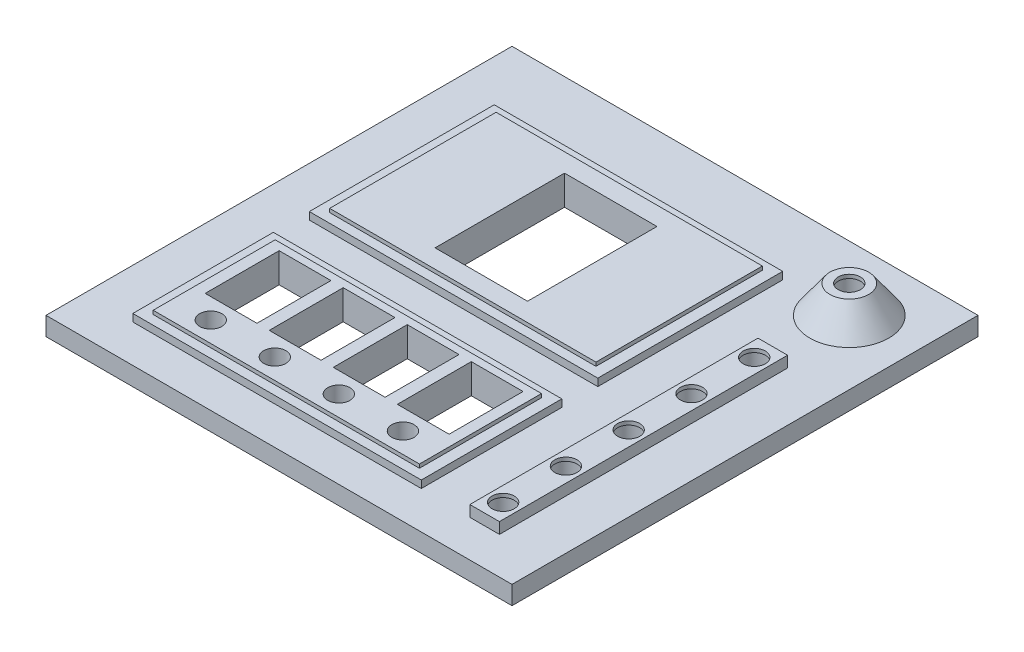
from build123d import *

# Parameters (mm, degrees)
SKETCH1_W           = 126
SKETCH1_H           = 126
BOSS_EXTRUDE1_DEPTH = 5
SKETCH3_R           = 12.5
BOSS_EXTRUDE2_DEPTH = 7.5
SKETCH4_R           = 3.45
CUT_EXTRUDE1_DEPTH  = 11.5
SKETCH6_R           = 3
CUT_EXTRUDE2_DEPTH  = 179.628805068
CHAMFER1_SIZE       = 10
CHAMFER1_SIZE_2     = 7.26542528
SKETCH7_W           = 8
SKETCH7_H           = 77.91635632
BOSS_EXTRUDE3_DEPTH = 3
SKETCH8_R           = 3
CUT_EXTRUDE3_DEPTH  = 179.370401132
SKETCH9_R           = 3.45
CUT_EXTRUDE4_DEPTH  = 7
SKETCH12_W          = 78
SKETCH12_H          = 50
SKETCH12_H_2        = 38
BOSS_EXTRUDE4_DEPTH = 2
SKETCH13_W          = 72
SKETCH13_H          = 45
BOSS_EXTRUDE5_DEPTH = 1
SKETCH14_W          = 72
SKETCH14_H          = 33
BOSS_EXTRUDE6_DEPTH = 1
SKETCH17_W          = 25
SKETCH17_H          = 35
CUT_EXTRUDE6_DEPTH  = 179.370401132
SKETCH18_W          = 14
SKETCH18_H          = 20
CUT_EXTRUDE7_DEPTH  = 179.370401132
SKETCH19_R          = 3
CUT_EXTRUDE8_DEPTH  = 179.370401132


with BuildPart() as part:
    # Sketch1 → Boss-Extrude1 (new body)
    with BuildSketch(Plane(origin=(0, 0, 0), x_dir=(1, 0, 0), z_dir=(0, 1, 0))):
        with Locations((63, 63)):
            Rectangle(SKETCH1_W, SKETCH1_H)
    extrude(amount=BOSS_EXTRUDE1_DEPTH)

    # Sketch3 → Boss-Extrude2 (add)
    with BuildSketch(Plane(origin=(0, 5, 0), x_dir=(1, 0, 0), z_dir=(0, 1, 0))):
        with Locations(Location((108.6, 108.6, 0), (0, 0, 90))):
            Circle(SKETCH3_R)
    extrude(amount=BOSS_EXTRUDE2_DEPTH)

    # Sketch4 → Cut-Extrude1 (cut)
    with BuildSketch(Plane.XZ):
        with Locations(Location((108.6, -108.6, 0), (0, 0, 270))):
            Circle(SKETCH4_R)
    extrude(amount=-CUT_EXTRUDE1_DEPTH, mode=Mode.SUBTRACT)

    # Sketch6 → Cut-Extrude2 (cut, through all)
    with BuildSketch(Plane(origin=(0, 12.5, 0), x_dir=(1, 0, 0), z_dir=(0, 1, 0))):
        with Locations(Location((108.6, 108.6, 0), (0, 0, 270))):
            Circle(SKETCH6_R)
    extrude(amount=-CUT_EXTRUDE2_DEPTH, mode=Mode.SUBTRACT)

    # Chamfer1
    # the kernel refuses this chamfer: 10, 7.26542528 mm, written as the material it takes off along each edge
    with BuildSketch(Plane(origin=(108.6, 12.5, -108.6), x_dir=(0, 0, -1), z_dir=(1, 0, 0))) as chamfer1_piece_1_section:
        Polygon((12.5, -CHAMFER1_SIZE), (12.5 - CHAMFER1_SIZE_2, 0), (12.5, 0), align=None)
    chamfer1_piece_1 = revolve(axis=Axis((108.6, 12.5, -108.6), (0, 1, 0)), mode=Mode.PRIVATE)
    chamfer1_piece_1 = split(chamfer1_piece_1, bisect_by=Plane(origin=(108.6, 5, -100.650989912), z_dir=(0, 1, 0)), keep=Keep.TOP, mode=Mode.PRIVATE)
    add(chamfer1_piece_1, mode=Mode.SUBTRACT)

    # Sketch7 → Boss-Extrude3 (add)
    with BuildSketch(Plane(origin=(0, 5, 0), x_dir=(1, 0, 0), z_dir=(0, 1, 0))):
        with Locations((108.6, 48.95817816)):
            Rectangle(SKETCH7_W, SKETCH7_H)
    extrude(amount=BOSS_EXTRUDE3_DEPTH)

    # Sketch8 → Cut-Extrude3 (cut, through all)
    with BuildSketch(Plane(origin=(0, 8, 0), x_dir=(1, 0, 0), z_dir=(0, 1, 0))):
        with Locations(Location((108.6, 15, 0), (0, 0, 270))):
            Circle(SKETCH8_R)
        with Locations(Location((108.6, 31.974801407, 0), (0, 0, 270))):
            Circle(SKETCH8_R)
        with Locations(Location((108.6, 48.949602814, 0), (0, 0, 270))):
            Circle(SKETCH8_R)
        with Locations(Location((108.6, 65.924404221, 0), (0, 0, 270))):
            Circle(SKETCH8_R)
        with Locations(Location((108.6, 82.899205628, 0), (0, 0, 270))):
            Circle(SKETCH8_R)
    extrude(amount=-CUT_EXTRUDE3_DEPTH, mode=Mode.SUBTRACT)

    # Sketch9 → Cut-Extrude4 (cut)
    with BuildSketch(Plane.XZ):
        with Locations(Location((108.6, -82.899205628, 0), (0, 0, 270))):
            Circle(SKETCH9_R)
        with Locations(Location((108.6, -65.924404221, 0), (0, 0, 270))):
            Circle(SKETCH9_R)
        with Locations(Location((108.6, -48.949602814, 0), (0, 0, 270))):
            Circle(SKETCH9_R)
        with Locations(Location((108.6, -15, 0), (0, 0, 270))):
            Circle(SKETCH9_R)
        with Locations(Location((108.6, -31.974801407, 0), (0, 0, 270))):
            Circle(SKETCH9_R)
    extrude(amount=-CUT_EXTRUDE4_DEPTH, mode=Mode.SUBTRACT)

    # Sketch12 → Boss-Extrude4 (add)
    with BuildSketch(Plane(origin=(0, 5, 0), x_dir=(1, 0, 0), z_dir=(0, 1, 0))):
        with Locations((52.3, 82.899205628)):
            Rectangle(SKETCH12_W, SKETCH12_H)
        with Locations((52.3, 29.174843528)):
            Rectangle(SKETCH12_W, SKETCH12_H_2)
    extrude(amount=BOSS_EXTRUDE4_DEPTH)

    # Sketch13 → Boss-Extrude5 (add)
    with BuildSketch(Plane(origin=(0, 7, 0), x_dir=(1, 0, 0), z_dir=(0, 1, 0))):
        with Locations((52.3, 82.899205628)):
            Rectangle(SKETCH13_W, SKETCH13_H)
    extrude(amount=BOSS_EXTRUDE5_DEPTH)

    # Sketch14 → Boss-Extrude6 (add)
    with BuildSketch(Plane(origin=(0, 7, 0), x_dir=(1, 0, 0), z_dir=(0, 1, 0))):
        with Locations((52.3, 29.174843528)):
            Rectangle(SKETCH14_W, SKETCH14_H)
    extrude(amount=BOSS_EXTRUDE6_DEPTH)

    # Sketch17 → Cut-Extrude6 (cut, through all)
    with BuildSketch(Plane(origin=(0, 8, 0), x_dir=(1, 0, 0), z_dir=(0, 1, 0))):
        with Locations((52.3, 82.899205628)):
            Rectangle(SKETCH17_W, SKETCH17_H)
    extrude(amount=-CUT_EXTRUDE6_DEPTH, mode=Mode.SUBTRACT)

    # Sketch18 → Cut-Extrude7 (cut, through all)
    with BuildSketch(Plane(origin=(0, 8, 0), x_dir=(1, 0, 0), z_dir=(0, 1, 0))):
        with Locations((43.701783173, 33.658480439)):
            Rectangle(SKETCH18_W, SKETCH18_H)
        with Locations((61.019882804, 33.658480439)):
            Rectangle(SKETCH18_W, SKETCH18_H)
        with Locations((78.337982434, 33.658480439)):
            Rectangle(SKETCH18_W, SKETCH18_H)
        with Locations((26.383683543, 33.658480439)):
            Rectangle(SKETCH18_W, SKETCH18_H)
    extrude(amount=-CUT_EXTRUDE7_DEPTH, mode=Mode.SUBTRACT)

    # Sketch19 → Cut-Extrude8 (cut, through all)
    with BuildSketch(Plane(origin=(0, 8, 0), x_dir=(1, 0, 0), z_dir=(0, 1, 0))):
        with Locations(Location((26.383683543, 18.166661984, 0), (0, 0, 270))):
            Circle(SKETCH19_R)
        with Locations(Location((43.701783173, 18.166661984, 0), (0, 0, 270))):
            Circle(SKETCH19_R)
        with Locations(Location((61.019882804, 18.166661984, 0), (0, 0, 270))):
            Circle(SKETCH19_R)
        with Locations(Location((78.337982434, 18.166661984, 0), (0, 0, 270))):
            Circle(SKETCH19_R)
    extrude(amount=-CUT_EXTRUDE8_DEPTH, mode=Mode.SUBTRACT)


solid = part.part
